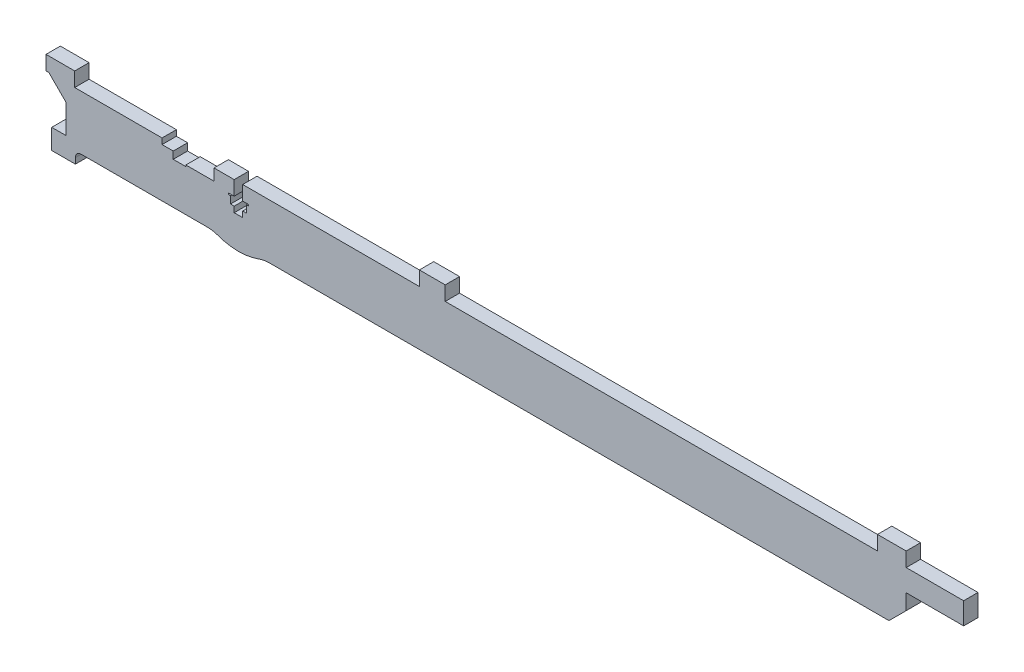
from build123d import *

# Parameters (mm, degrees)
BOSS_EXTRUDE1_DEPTH = 5
CHAMFER1_SIZE       = 6
CUT_EXTRUDE2_DEPTH  = 302.131300266


with BuildPart() as part:
    # Sketch1 → Boss-Extrude1 (new body)
    with BuildSketch(Plane.XY):
        with BuildLine():
            Line((-250.8, 3.6), (-241, 3.6))
            Line((-241, 3.6), (-241, 7.6))
            Line((-241, 7.6), (-233.98, 7.6))
            Line((-233.98, 7.6), (-233.98, 2.6))
            Line((-233.98, 2.6), (-236, 2.6))
            Line((-236, 2.6), (-236, 2.1))
            Line((-236, 2.1), (-235.25, 2.1))
            Line((-235.25, 2.1), (-235.25, -0.4))
            Line((-235.25, -0.4), (-233.98, -0.4))
            Line((-233.98, -0.4), (-233.98, -2.4))
            Line((-233.98, -2.4), (-231.02, -2.4))
            Line((-231.02, -2.4), (-231.02, -0.4))
            Line((-231.02, -0.4), (-229.75, -0.4))
            Line((-229.75, -0.4), (-229.75, 2.1))
            Line((-229.75, 2.1), (-229, 2.1))
            Line((-229, 2.1), (-229, 2.6))
            Line((-229, 2.6), (-231.02, 2.6))
            Line((-231.02, 2.6), (-231.02, 7.6))
            Line((-231.02, 7.6), (-169.5, 7.6))
            Line((-169.5, 7.6), (-169.5, 12.6))
            Line((-169.5, 12.6), (-160.5, 12.6))
            Line((-160.5, 12.6), (-160.5, 7.6))
            Line((-160.5, 7.6), (-10, 7.6))
            Line((-10, 7.6), (-10, 12.6))
            Line((-10, 12.6), (0, 12.6))
            Line((0, 12.6), (0, 7.6))
            Line((0, 7.6), (20, 7.6))
            Line((20, 7.6), (20, 0))
            Line((20, 0), (0, 0))
            Line((0, 0), (0, -11.4))
            Line((0, -11.4), (-221.799463771, -11.4))
            ThreePointArc((-221.799463771, -11.4), (-223.557706142, -11.555784248), (-225.261167219, -12.018283247))
            ThreePointArc((-225.261167219, -12.018283247), (-232.5, -13.3111869), (-239.738832781, -12.018283247))
            ThreePointArc((-239.738832781, -12.018283247), (-241.442293858, -11.555784248), (-243.200536229, -11.4))
            Line((-243.200536229, -11.4), (-287.270831989, -11.4))
            ThreePointArc((-287.270831989, -11.4), (-289.270831989, -13.4), (-287.270831989, -15.4))
            Line((-287.270831989, -15.4), (-282, -15.4))
            Line((-282, -15.4), (-282, -18.281197846))
            Line((-282, -18.281197846), (-283, -20.013248654))
            Line((-283, -20.013248654), (-286, -18.281197846))
            Line((-286, -18.281197846), (-290, -20.590598923))
            Line((-290, -20.590598923), (-290, -25.209401077))
            Line((-290, -25.209401077), (-286, -27.518802154))
            Line((-286, -27.518802154), (-283, -25.786751346))
            Line((-283, -25.786751346), (-282, -27.518802154))
            Line((-282, -27.518802154), (-282, -30.9))
            Line((-282, -30.9), (-297.5, -30.9))
            Line((-297.5, -30.9), (-297.5, -8.4))
            Line((-297.5, -8.4), (-292.5, -8.4))
            Line((-292.5, -8.4), (-292.5, 1.6))
            Line((-292.5, 1.6), (-298.5, 7.6))
            Line((-298.5, 7.6), (-299.5, 7.6))
            Line((-299.5, 7.6), (-299.5, 12.6))
            Line((-299.5, 12.6), (-289.5, 12.6))
            Line((-289.5, 12.6), (-289.5, 7.6))
            Line((-289.5, 7.6), (-259.093151184, 7.6))
            Line((-259.093151184, 7.6), (-259.093151184, 5.6))
            Line((-259.093151184, 5.6), (-255.2, 5.6))
            Line((-255.2, 5.6), (-255.2, 3.1))
            Line((-255.2, 3.1), (-250.8, 3.1))
            Line((-250.8, 3.1), (-250.8, 3.6))
        make_face()
    extrude(amount=BOSS_EXTRUDE1_DEPTH)

    # Chamfer1
    chamfer1_edges = [part.edges().sort_by_distance(p)[0] for p in [
        (0, -11.4, 2.5),
    ]]
    chamfer(chamfer1_edges, length=CHAMFER1_SIZE)

    # Sketch3 → Cut-Extrude2 (cut, through all)
    with BuildSketch(Plane.XY.offset(5)):
        Polygon((-289.270831989, -13.4), (-289.270831989, -15.4), (-297.5, -15.4), (-297.5, -30.9), (-282, -30.9), (-282, -13.4), align=None)
    extrude(amount=-CUT_EXTRUDE2_DEPTH, mode=Mode.SUBTRACT)


solid = part.part
